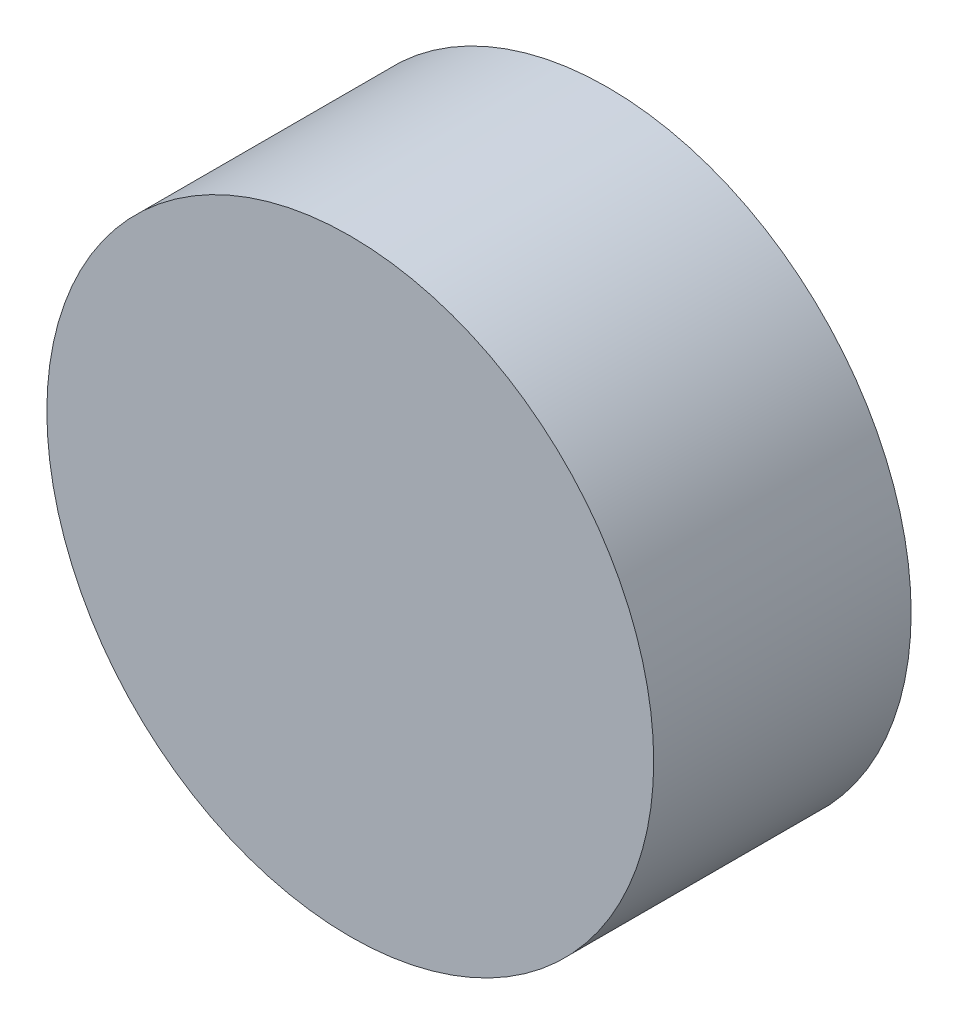
from build123d import *

# Parameters (mm, degrees)
AUFSATZ_LINEAR_AUSTRAGEN1_DEPTH      = 3
AUFSATZ_LINEAR_AUSTRAGEN1_DEPTH_BACK = 19
SKIZZE1_R                            = 25.930521342
SKIZZE1_R_2                          = 22.930521342
SKIZZE3_R                            = 25.930521342
AUFSATZ_LINEAR_AUSTRAGEN5_DEPTH      = 3
SKIZZE4_R                            = 16.2
AUFSATZ_LINEAR_AUSTRAGEN6_DEPTH      = 7
SKIZZE5_R                            = 5
AUFSATZ_LINEAR_AUSTRAGEN7_DEPTH      = 3
SKIZZE6_R                            = 1.8
SCHNITT_LINEAR_AUSTRAGEN1_DEPTH      = 4
FASE1_SIZE2                          = 1.732050808
FASE1_SIZE                           = 3
AUFSATZ_LINEAR_AUSTRAGEN9_DEPTH      = 22
SKIZZE8_R                            = 22.930521342
SKIZZE8_R_2                          = 19.876721744
AUFSATZ_LINEAR_AUSTRAGEN10_DEPTH     = 4


with BuildPart() as part:
    # Skizze1 → Aufsatz-Linear austragen1 (new, two sides: drawn at the far end of the back side and taken through both)
    with BuildSketch(Plane.XY.offset(-AUFSATZ_LINEAR_AUSTRAGEN1_DEPTH_BACK)):
        with Locations((0, -12)):
            Circle(SKIZZE1_R)
        with Locations((0, -12)):
            Circle(SKIZZE1_R_2, mode=Mode.SUBTRACT)
    extrude(amount=AUFSATZ_LINEAR_AUSTRAGEN1_DEPTH + AUFSATZ_LINEAR_AUSTRAGEN1_DEPTH_BACK)

    # Skizze3 → Aufsatz-Linear austragen5 (add)
    with BuildSketch(Plane.XY.offset(3)):
        with Locations((0, -12)):
            Circle(SKIZZE3_R)
    extrude(amount=-AUFSATZ_LINEAR_AUSTRAGEN5_DEPTH)

    # Skizze4 → Aufsatz-Linear austragen6 (add)
    with BuildSketch(Plane.XY.offset(-4)):
        with Locations(Location((0, -12, 0), (0, 0, 180))):
            Circle(SKIZZE4_R)
    extrude(amount=AUFSATZ_LINEAR_AUSTRAGEN6_DEPTH)

    # Skizze5 → Aufsatz-Linear austragen7 (add)
    with BuildSketch(Plane(origin=(0, 0, -4), x_dir=(-1, 0, 0), z_dir=(0, 0, -1))):
        with Locations((0, -12)):
            Circle(SKIZZE5_R)
    extrude(amount=AUFSATZ_LINEAR_AUSTRAGEN7_DEPTH)

    # Skizze6 → Schnitt-Linear austragen1 (cut)
    with BuildSketch(Plane(origin=(0, 0, -7), x_dir=(-1, 0, 0), z_dir=(0, 0, -1))):
        with Locations((0, -12)):
            Circle(SKIZZE6_R)
    extrude(amount=-SCHNITT_LINEAR_AUSTRAGEN1_DEPTH, mode=Mode.SUBTRACT)

    # Fase1
    fase1_edges = [part.edges().sort_by_distance(p)[0] for p in [
        (5, -12, -7),
    ]]
    fase1_side = [part.faces().sort_by_distance(p)[0] for p in [
        (5, -12, -6.965358984),
    ]]
    chamfer(fase1_edges, length=FASE1_SIZE - 0.0001, length2=FASE1_SIZE2 - 0.0001, reference=fase1_side[0])  # a hair under: the kernel refuses the full size

    # Skizze7 → Aufsatz-Linear austragen9 (add, through all)
    with BuildSketch(Plane(origin=(0, 0, -19), x_dir=(-1, 0, 0), z_dir=(0, 0, -1))):
        with BuildLine():
            ThreePointArc((2.505273763, 7.831283857), (2.06069756, 9.305009245), (2, 10.843134833))
            ThreePointArc((2, 10.843134833), (2.873956387, 10.749707332), (3.743690302, 10.622855521))
            ThreePointArc((3.743690302, 10.622855521), (3.302383388, 9.148147846), (2.505273763, 7.831283857))
        make_face()
        with BuildLine():
            ThreePointArc((7.358405726, 6.585211358), (7.294297302, 8.123198559), (7.618022946, 9.628095972))
            ThreePointArc((7.618022946, 9.628095972), (8.441287912, 9.320259553), (9.252150774, 8.981098995))
            ThreePointArc((9.252150774, 8.981098995), (8.457963443, 7.66247054), (7.358405726, 6.585211358))
        make_face()
        with BuildLine():
            ThreePointArc((11.749181995, 4.171361678), (12.069569518, 5.676973299), (12.757377494, 7.054084299))
            ThreePointArc((12.757377494, 7.054084299), (13.478222272, 6.551181455), (14.179264585, 6.021022857))
            ThreePointArc((14.179264585, 6.021022857), (13.082098549, 4.941327897), (11.749181995, 4.171361678))
        make_face()
        with BuildLine():
            ThreePointArc((15.401713948, 0.741405869), (16.086466292, 2.120038796), (17.095139095, 3.282834433))
            ThreePointArc((17.095139095, 3.282834433), (17.668270357, 2.616464401), (18.215443056, 1.928619576))
            ThreePointArc((18.215443056, 1.928619576), (16.88423729, 1.155699317), (15.401713948, 0.741405869))
        make_face()
        with BuildLine():
            ThreePointArc((18.08649957, -3.48913933), (19.092591227, -2.324109675), (20.358750235, -1.448692126))
            ThreePointArc((20.358750235, -1.448692126), (20.748156037, -2.236658868), (21.107078247, -3.038970099))
            ThreePointArc((21.107078247, -3.038970099), (19.625477306, -3.456550236), (18.08649957, -3.48913933))
        make_face()
        with BuildLine():
            ThreePointArc((19.634843907, -8.254453206), (20.899058438, -7.376229921), (22.343146224, -6.843196164))
            ThreePointArc((22.343146224, -6.843196164), (22.524358766, -7.703248767), (22.672478085, -8.569614239))
            ThreePointArc((22.672478085, -8.569614239), (21.133576405, -8.605616157), (19.634843907, -8.254453206))
        make_face()
        with BuildLine():
            ThreePointArc((19.94945879, -13.255113562), (21.392360946, -12.718878645), (22.923640163, -12.561721153))
            ThreePointArc((22.923640163, -12.561721153), (22.885273196, -13.439819348), (22.813282742, -14.315802133))
            ThreePointArc((22.813282742, -14.315802133), (21.313775176, -13.967963699), (19.94945879, -13.255113562))
        make_face()
        with BuildLine():
            ThreePointArc((19.010575807, -18.176910517), (20.54150274, -18.01635758), (22.063757484, -18.244951136))
            ThreePointArc((22.063757484, -18.244951136), (21.808221744, -19.085920784), (21.520644943, -19.916479661))
            ThreePointArc((21.520644943, -19.916479661), (20.154751065, -19.206656844), (19.010575807, -18.176910517))
        make_face()
        with BuildLine():
            ThreePointArc((16.877188431, -22.710589467), (18.399946371, -22.935806642), (19.817527777, -23.535787871))
            ThreePointArc((19.817527777, -23.535787871), (19.360879515, -24.286787758), (18.875785875, -25.019735658))
            ThreePointArc((18.875785875, -25.019735658), (17.729329821, -23.992529235), (16.877188431, -22.710589467))
        make_face()
        with BuildLine():
            ThreePointArc((13.683345236, -26.57128269), (15.1022537, -27.168118754), (16.326089916, -28.101788629))
            ThreePointArc((16.326089916, -28.101788629), (15.697022022, -28.715630668), (15.04489176, -29.30491378))
            ThreePointArc((15.04489176, -29.30491378), (14.18990958, -28.024866909), (13.683345236, -26.57128269))
        make_face()
        with BuildLine():
            ThreePointArc((9.629727135, -29.516408632), (10.855630888, -30.44736218), (11.808823782, -31.656054789))
            ThreePointArc((11.808823782, -31.656054789), (11.046862905, -32.094169029), (10.268671764, -32.502760526))
            ThreePointArc((10.268671764, -32.502760526), (9.758885134, -31.05030326), (9.629727135, -29.516408632))
        make_face()
        with BuildLine():
            ThreePointArc((4.971037863, -31.360914199), (5.926908862, -32.567489995), (6.549565821, -33.975258737))
            ThreePointArc((6.549565821, -33.975258737), (5.702588765, -34.210116847), (4.847233356, -34.412343425))
            ThreePointArc((4.847233356, -34.412343425), (4.714674044, -32.878738995), (4.971037863, -31.360914199))
        make_face()
        with BuildLine():
            ThreePointArc((0, -31.988902322), (0.625777356, -33.395286772), (0.878774551, -34.913676359))
            ThreePointArc((0.878774551, -34.913676359), (0, -34.930521342), (-0.878774551, -34.913676359))
            ThreePointArc((-0.878774551, -34.913676359), (-0.625777356, -33.395286772), (0, -31.988902322))
        make_face()
        with BuildLine():
            ThreePointArc((-4.971037863, -31.360914199), (-4.714674044, -32.878738995), (-4.847233356, -34.412343425))
            ThreePointArc((-4.847233356, -34.412343425), (-5.702588765, -34.210116847), (-6.549565821, -33.975258737))
            ThreePointArc((-6.549565821, -33.975258737), (-5.926908862, -32.567489995), (-4.971037863, -31.360914199))
        make_face()
        with BuildLine():
            ThreePointArc((-9.629727135, -29.516408632), (-9.758885134, -31.05030326), (-10.268671764, -32.502760526))
            ThreePointArc((-10.268671764, -32.502760526), (-11.046862905, -32.094169029), (-11.808823782, -31.656054789))
            ThreePointArc((-11.808823782, -31.656054789), (-10.855630888, -30.44736218), (-9.629727135, -29.516408632))
        make_face()
        with BuildLine():
            ThreePointArc((-13.683345236, -26.57128269), (-14.18990958, -28.024866909), (-15.04489176, -29.30491378))
            ThreePointArc((-15.04489176, -29.30491378), (-15.697022022, -28.715630668), (-16.326089916, -28.101788629))
            ThreePointArc((-16.326089916, -28.101788629), (-15.1022537, -27.168118754), (-13.683345236, -26.57128269))
        make_face()
        with BuildLine():
            ThreePointArc((-16.877188431, -22.710589467), (-17.729329821, -23.992529235), (-18.875785875, -25.019735658))
            ThreePointArc((-18.875785875, -25.019735658), (-19.360879515, -24.286787758), (-19.817527777, -23.535787871))
            ThreePointArc((-19.817527777, -23.535787871), (-18.399946371, -22.935806642), (-16.877188431, -22.710589467))
        make_face()
        with BuildLine():
            ThreePointArc((-19.010575807, -18.176910517), (-20.154751065, -19.206656844), (-21.520644943, -19.916479661))
            ThreePointArc((-21.520644943, -19.916479661), (-21.808221744, -19.085920784), (-22.063757484, -18.244951136))
            ThreePointArc((-22.063757484, -18.244951136), (-20.54150274, -18.01635758), (-19.010575807, -18.176910517))
        make_face()
        with BuildLine():
            ThreePointArc((-19.94945879, -13.255113562), (-21.313775176, -13.967963699), (-22.813282742, -14.315802133))
            ThreePointArc((-22.813282742, -14.315802133), (-22.885273196, -13.439819348), (-22.923640163, -12.561721153))
            ThreePointArc((-22.923640163, -12.561721153), (-21.392360946, -12.718878645), (-19.94945879, -13.255113562))
        make_face()
        with BuildLine():
            ThreePointArc((-19.634843907, -8.254453206), (-21.133576405, -8.605616157), (-22.672478085, -8.569614239))
            ThreePointArc((-22.672478085, -8.569614239), (-22.524358766, -7.703248767), (-22.343146224, -6.843196164))
            ThreePointArc((-22.343146224, -6.843196164), (-20.899058438, -7.376229921), (-19.634843907, -8.254453206))
        make_face()
        with BuildLine():
            ThreePointArc((-18.08649957, -3.48913933), (-19.625477306, -3.456550236), (-21.107078247, -3.038970099))
            ThreePointArc((-21.107078247, -3.038970099), (-20.748156037, -2.236658868), (-20.358750235, -1.448692126))
            ThreePointArc((-20.358750235, -1.448692126), (-19.092591227, -2.324109675), (-18.08649957, -3.48913933))
        make_face()
        with BuildLine():
            ThreePointArc((-15.401713948, 0.741405869), (-16.88423729, 1.155699317), (-18.215443056, 1.928619576))
            ThreePointArc((-18.215443056, 1.928619576), (-17.668270357, 2.616464401), (-17.095139095, 3.282834433))
            ThreePointArc((-17.095139095, 3.282834433), (-16.086466292, 2.120038796), (-15.401713948, 0.741405869))
        make_face()
        with BuildLine():
            ThreePointArc((-11.749181995, 4.171361678), (-13.082098549, 4.941327897), (-14.179264585, 6.021022857))
            ThreePointArc((-14.179264585, 6.021022857), (-13.478222272, 6.551181455), (-12.757377494, 7.054084299))
            ThreePointArc((-12.757377494, 7.054084299), (-12.069569518, 5.676973299), (-11.749181995, 4.171361678))
        make_face()
        with BuildLine():
            ThreePointArc((-7.358405726, 6.585211358), (-8.457963443, 7.66247054), (-9.252150774, 8.981098995))
            ThreePointArc((-9.252150774, 8.981098995), (-8.441287912, 9.320259553), (-7.618022946, 9.628095972))
            ThreePointArc((-7.618022946, 9.628095972), (-7.294297302, 8.123198559), (-7.358405726, 6.585211358))
        make_face()
        with BuildLine():
            ThreePointArc((-2.505273763, 7.831283857), (-3.302383388, 9.148147846), (-3.743690302, 10.622855521))
            ThreePointArc((-3.743690302, 10.622855521), (-2.873956387, 10.749707332), (-2, 10.843134833))
            ThreePointArc((-2, 10.843134833), (-2.06069756, 9.305009245), (-2.505273763, 7.831283857))
        make_face()
    extrude(amount=-AUFSATZ_LINEAR_AUSTRAGEN9_DEPTH)

    # Skizze8 → Aufsatz-Linear austragen10 (add)
    with BuildSketch(Plane(origin=(0, 0, -7.5), x_dir=(-1, 0, 0), z_dir=(0, 0, -1))):
        with Locations((0, -12)):
            Circle(SKIZZE8_R)
        with Locations(Location((0, -12.035270763, 0), (0, 0, 180))):
            Circle(SKIZZE8_R_2, mode=Mode.SUBTRACT)
    extrude(amount=AUFSATZ_LINEAR_AUSTRAGEN10_DEPTH)


solid = part.part
